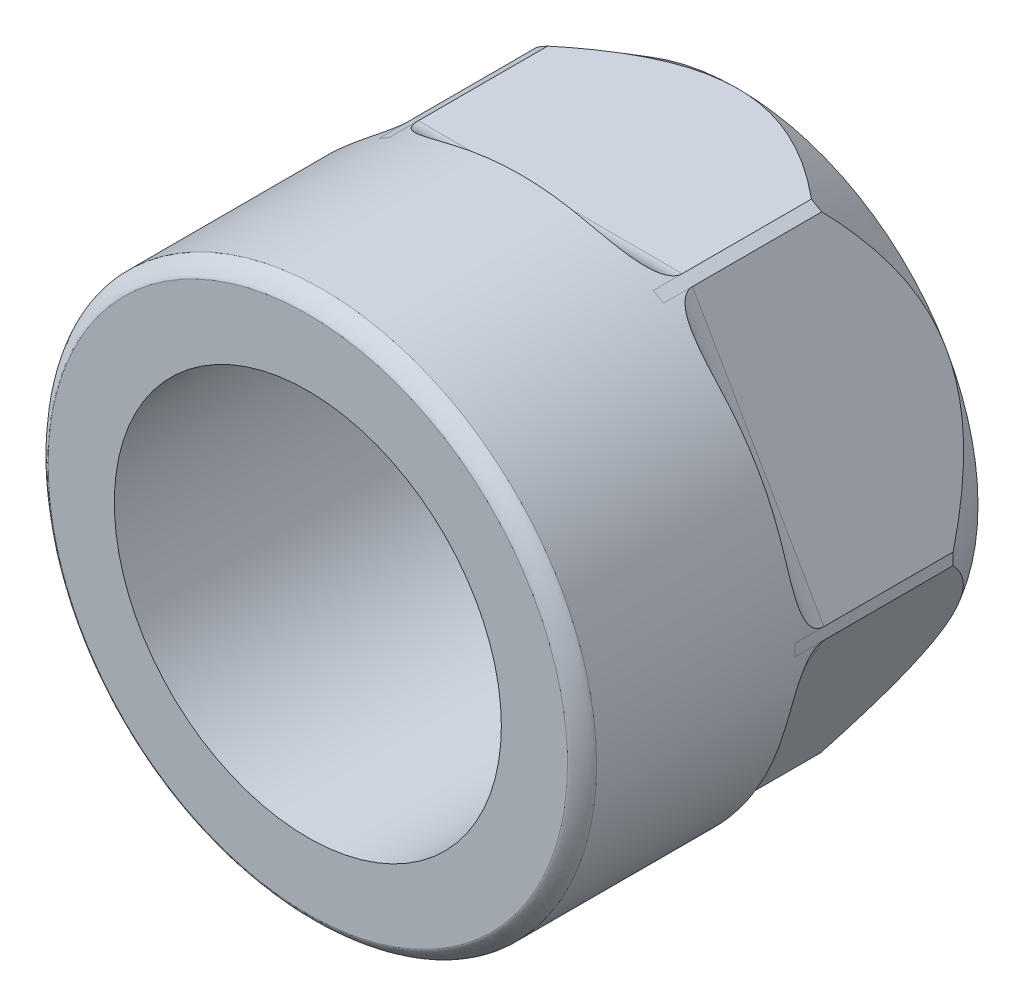
from build123d import *

# Parameters (mm, degrees)
ESBO_O1_R                   = 9.43
RESSALTO_EXTRUS_O1_DEPTH    = 7.32
RESSALTO_EXTRUS_O3_DEPTH    = 7.46
FILETE2_R                   = 1
FILETE5_SIZE                = 0.5
ESBO_O11_R                  = 6.655
CORTE_EXTRUS_O11_DEPTH      = 7
CORTE_EXTRUS_O12_DEPTH      = 21
CORTE_EXTRUS_O12_DEPTH_BACK = 25
ESBO_O13_R                  = 4.615


with BuildPart() as part:
    # Esboço1 → Ressalto-extrusão1 (new body)
    with BuildSketch(Plane.XY):
        Circle(ESBO_O1_R)
    extrude(amount=RESSALTO_EXTRUS_O1_DEPTH)

    # Esboço6 → Ressalto-extrusão3 (add)
    with BuildSketch(Plane(origin=(0, 0, 0), x_dir=(-1, 0, 0), z_dir=(0, 0, -1))):
        Polygon((-4.553953946, 8.257505886), (-4.907743295, 8.052264014), (-9.428186842, 0.184913138), (-9.427336842, -0.224098362), (-4.874232896, -8.072592748), (-4.519593546, -8.276362376), (4.553953946, -8.257505886), (4.907743295, -8.052264014), (9.428186842, -0.184913138), (9.427336842, 0.224098362), (4.874232896, 8.072592748), (4.519593546, 8.276362376), align=None)
    extrude(amount=RESSALTO_EXTRUS_O3_DEPTH)

    # Filete2
    # the kernel refuses this fillet: 1 mm, written as the material it adds along each edge
    with BuildSketch(Plane(origin=(-7.019588148, 8.281557821, 0), x_dir=(0.00207817826330444, 0.9999978405852215, 0), z_dir=(0.9999978405852215, -0.00207817826330444, 0))) as filete2_piece_1_section:
        with BuildLine():
            CenterArc((FILETE2_R, -FILETE2_R), FILETE2_R, 90, 90)
            Line((0, -FILETE2_R), (0, 0))
            Line((0, 0), (FILETE2_R, 0))
        make_face()
    filete2_piece_1 = extrude(amount=14.073567086, mode=Mode.PRIVATE)
    filete2_piece_1 = filete2_piece_1 & Plane(origin=(0, 0, 0), x_dir=(1, 0, 0), z_dir=(0, 0, -1)) * Cylinder(9.43, 33, mode=Mode.PRIVATE)
    filete2_piece_1 = split(filete2_piece_1, bisect_by=Plane(origin=(-6.396839192, 7.197729543, 0), z_dir=(0.4981991651229168, -0.8670626228080811, 0)), keep=Keep.TOP, mode=Mode.PRIVATE)
    add(filete2_piece_1)
    with BuildSketch(Plane(origin=(3.662245382, 10.219920571, 0), x_dir=(0.8670626228080417, 0.49819916512298523, 0), z_dir=(0.4981991651229853, -0.8670626228080418, 0))) as filete2_piece_2_section:
        with BuildLine():
            CenterArc((FILETE2_R, -FILETE2_R), FILETE2_R, 90, 90)
            Line((0, -FILETE2_R), (0, 0))
            Line((0, 0), (FILETE2_R, 0))
        make_face()
    filete2_piece_2 = extrude(amount=14.073567086, mode=Mode.PRIVATE)
    filete2_piece_2 = filete2_piece_2 & Plane(origin=(0, 0, 0), x_dir=(1, 0, 0), z_dir=(0, 0, -1)) * Cylinder(9.43, 33, mode=Mode.PRIVATE)
    filete2_piece_2 = split(filete2_piece_2, bisect_by=Plane(origin=(3.034997038, 9.138690015, 0), z_dir=(-0.501798675462167, -0.8649844445447645, 0)), keep=Keep.TOP, mode=Mode.PRIVATE)
    add(filete2_piece_2)
    with BuildSketch(Plane(origin=(10.68183353, 1.93836275, 0), x_dir=(0.864984444544716, -0.5017986754622507, 0), z_dir=(-0.5017986754622507, -0.8649844445447161, 0))) as filete2_piece_3_section:
        with BuildLine():
            CenterArc((FILETE2_R, -FILETE2_R), FILETE2_R, 90, 90)
            Line((0, -FILETE2_R), (0, 0))
            Line((0, 0), (FILETE2_R, 0))
        make_face()
    filete2_piece_3 = extrude(amount=14.073567086, mode=Mode.PRIVATE)
    filete2_piece_3 = filete2_piece_3 & Plane(origin=(0, 0, 0), x_dir=(1, 0, 0), z_dir=(0, 0, -1)) * Cylinder(9.43, 33, mode=Mode.PRIVATE)
    filete2_piece_3 = split(filete2_piece_3, bisect_by=Plane(origin=(13.56480426, -3.079140967, 0), z_dir=(-0.49819916512298634, 0.8670626228080411, 0)), keep=Keep.TOP, mode=Mode.PRIVATE)
    add(filete2_piece_3)
    with BuildSketch(Plane(origin=(-3.662245382, -10.219920571, 0), x_dir=(-0.867062622808062, -0.49819916512295004, 0), z_dir=(-0.4981991651229501, 0.867062622808062, 0))) as filete2_piece_4_section:
        with BuildLine():
            CenterArc((FILETE2_R, -FILETE2_R), FILETE2_R, 90, 90)
            Line((0, -FILETE2_R), (0, 0))
            Line((0, 0), (FILETE2_R, 0))
        make_face()
    filete2_piece_4 = extrude(amount=14.073567086, mode=Mode.PRIVATE)
    filete2_piece_4 = filete2_piece_4 & Plane(origin=(0, 0, 0), x_dir=(1, 0, 0), z_dir=(0, 0, -1)) * Cylinder(9.43, 33, mode=Mode.PRIVATE)
    filete2_piece_4 = split(filete2_piece_4, bisect_by=Plane(origin=(-3.034997038, -9.138690015, 0), z_dir=(0.5017986754622314, 0.8649844445447271, 0)), keep=Keep.TOP, mode=Mode.PRIVATE)
    add(filete2_piece_4)
    with BuildSketch(Plane(origin=(-10.68183353, -1.93836275, 0), x_dir=(-0.864984444544708, 0.5017986754622645, 0), z_dir=(0.5017986754622645, 0.8649844445447079, 0))) as filete2_piece_5_section:
        with BuildLine():
            CenterArc((FILETE2_R, -FILETE2_R), FILETE2_R, 90, 90)
            Line((0, -FILETE2_R), (0, 0))
            Line((0, 0), (FILETE2_R, 0))
        make_face()
    filete2_piece_5 = extrude(amount=14.073567086, mode=Mode.PRIVATE)
    filete2_piece_5 = filete2_piece_5 & Plane(origin=(0, 0, 0), x_dir=(1, 0, 0), z_dir=(0, 0, -1)) * Cylinder(9.43, 33, mode=Mode.PRIVATE)
    filete2_piece_5 = split(filete2_piece_5, bisect_by=Plane(origin=(-9.431836229, -1.940960472, 0), z_dir=(0.9999978405852215, -0.0020781782633334765, 0)), keep=Keep.TOP, mode=Mode.PRIVATE)
    add(filete2_piece_5)
    with BuildSketch(Plane(origin=(7.019588148, -8.281557821, 0), x_dir=(-0.002078178263315457, -0.9999978405852215, 0), z_dir=(-0.9999978405852215, 0.002078178263315457, 0))) as filete2_piece_6_section:
        with BuildLine():
            CenterArc((FILETE2_R, -FILETE2_R), FILETE2_R, 90, 90)
            Line((0, -FILETE2_R), (0, 0))
            Line((0, 0), (FILETE2_R, 0))
        make_face()
    filete2_piece_6 = extrude(amount=14.073567086, mode=Mode.PRIVATE)
    filete2_piece_6 = filete2_piece_6 & Plane(origin=(0, 0, 0), x_dir=(1, 0, 0), z_dir=(0, 0, -1)) * Cylinder(9.43, 33, mode=Mode.PRIVATE)
    filete2_piece_6 = split(filete2_piece_6, bisect_by=Plane(origin=(6.396839192, -7.197729543, 0), z_dir=(-0.49819916512298634, 0.8670626228080411, 0)), keep=Keep.TOP, mode=Mode.PRIVATE)
    add(filete2_piece_6)

    # Filete5
    # a fillet whose section is not a circle: 0.5 mm, written as the material it takes off along each edge
    with BuildSketch(Plane(origin=(0, 0, 7.32), x_dir=(1, 0, 0), z_dir=(0, -1, 0))) as filete5_piece_1:
        with BuildLine():
            Bezier((9.43, -FILETE5_SIZE), (9.43, 0), (9.43 - FILETE5_SIZE, 0), weights=[1, 0.176776695, 1])
            Line((9.43 - FILETE5_SIZE, 0), (9.43, 0))
            Line((9.43, 0), (9.43, -FILETE5_SIZE))
        make_face()
    revolve(axis=Axis((0, 0, 7.32), (0, 0, 1)), mode=Mode.SUBTRACT)

    # Esboço11 → Corte-extrusão11 (cut)
    with BuildSketch(Plane.XY.offset(7.32)):
        Circle(ESBO_O11_R)
    extrude(amount=-CORTE_EXTRUS_O11_DEPTH, mode=Mode.SUBTRACT)

    # Esboço13 → Corte-extrusão12 (cut, two sides: drawn at the far end of the back side and taken through both)
    with BuildSketch(Plane(origin=(0, 0, -7.46), x_dir=(-1, 0, 0), z_dir=(0, 0, -1)).offset(-CORTE_EXTRUS_O12_DEPTH_BACK)):
        with Locations(Location((0, 0, 0), (0, 0, 180))):
            Circle(ESBO_O13_R)
    extrude(amount=CORTE_EXTRUS_O12_DEPTH + CORTE_EXTRUS_O12_DEPTH_BACK, mode=Mode.SUBTRACT)

    # Chanfro7: read off the stored shape, not the designer's step
    # Chanfro7 outline → Chanfro7 (revolve, cut)
    with BuildSketch(Plane.XZ):
        Polygon((4.615, -2.68), (6.655, -2.133383647), (6.655, 0.32), (4.615, 0.32), align=None)
    revolve(axis=Axis((0, 0, 0), (0, 0, 1)), mode=Mode.SUBTRACT)

    # Filete6
    # a fillet whose section is not a circle: 2.5 mm, written as the material it takes off along each edge
    with BuildSketch(Plane(origin=(0, 0, -2.68), x_dir=(1, 0, 0), z_dir=(0, -1, 0))) as filete6_piece_1:
        with BuildLine():
            Bezier((4.615, -1.91831747), (4.615, 0), (6.467952387, 0.496497096), weights=[1, 0.991691675, 1])
            Line((6.467952387, 0.496497096), (4.615, 0))
            Line((4.615, 0), (4.615, -1.91831747))
        make_face()
    revolve(axis=Axis((0, 0, -2.68), (0, 0, 1)), mode=Mode.SUBTRACT)

    # Corte-extrusão13: read off the stored shape, not the designer's step
    # Corte-extrusão13 outline → Corte-extrusão13 (revolve, cut)
    with BuildSketch(Plane.XZ):
        Polygon((9.430000012, -5.445541722), (8.266951983, -7.46), (9.430000012, -7.46), align=None)
    revolve(axis=Axis((0, 0, 0), (0, 0, 1)), mode=Mode.SUBTRACT)


solid = part.part
